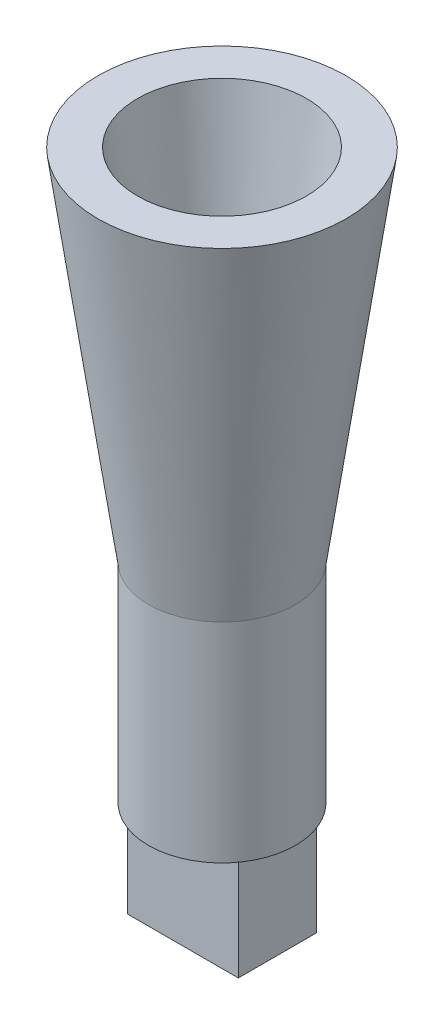
from build123d import *

# Parameters (mm, degrees)
SKETCH1_W           = 108
SKETCH1_H           = 76.2
BOSS_EXTRUDE1_DEPTH = 101.6
SKETCH2_R           = 71.616075106
BOSS_EXTRUDE2_DEPTH = 203.2
SKETCH4_R           = 71.616075106
BOSS_EXTRUDE3_DEPTH = 350
BOSS_EXTRUDE3_DRAFT = -8


# Read off the part's stored shape, not the designer's step: Shell1
with BuildPart() as part:
    # Sketch1 → Boss-Extrude1 (new body)
    with BuildSketch(Plane(origin=(0, 0, 0), x_dir=(1, 0, 0), z_dir=(0, 1, 0))):
        Rectangle(SKETCH1_W, SKETCH1_H)
    extrude(amount=BOSS_EXTRUDE1_DEPTH)

    # Sketch2 → Boss-Extrude2 (add)
    with BuildSketch(Plane(origin=(0, 101.6, 0), x_dir=(1, 0, 0), z_dir=(0, 1, 0))):
        with Locations(Location((0, 0, 0), (0, 0, 270))):
            Circle(SKETCH2_R)
    extrude(amount=BOSS_EXTRUDE2_DEPTH)


with BuildPart() as boss_extrude3_tool:
    # Sketch4 → Boss-Extrude3 (with draft: the straight prism first)
    with BuildSketch(Plane(origin=(0, 304.8, 0), x_dir=(1, 0, 0), z_dir=(0, 1, 0))):
        with Locations(Location((0, 0, 0), (0, 0, 270))):
            Circle(SKETCH4_R)
    extrude(amount=BOSS_EXTRUDE3_DEPTH)
    # Boss-Extrude3: the draft: its side faces are tilted about the plane it starts from
    boss_extrude3_sides = [boss_extrude3_tool.faces().sort_by_distance(p)[0] for p in [
        (0, 479.8, -71.616075106),
    ]]
    draft(boss_extrude3_sides, Plane(origin=(0, 304.8, 0), x_dir=(1, 0, 0), z_dir=(0, 1, 0)), BOSS_EXTRUDE3_DRAFT)


with BuildPart() as part_1:
    add(part.part)

    # Boss-Extrude3: add boss_extrude3_tool
    add(boss_extrude3_tool.part)

    # Shell1 outline → Shell1 (revolve, cut)
    with BuildSketch(Plane.XY):
        Polygon((0, 654.8), (0, 139.7), (33.516075106, 139.7), (33.516075106, 307.464211535), (82.330936739, 654.8), align=None)
    revolve(axis=Axis((0, 0, 0), (0, 1, 0)), mode=Mode.SUBTRACT)


solid = part_1.part
